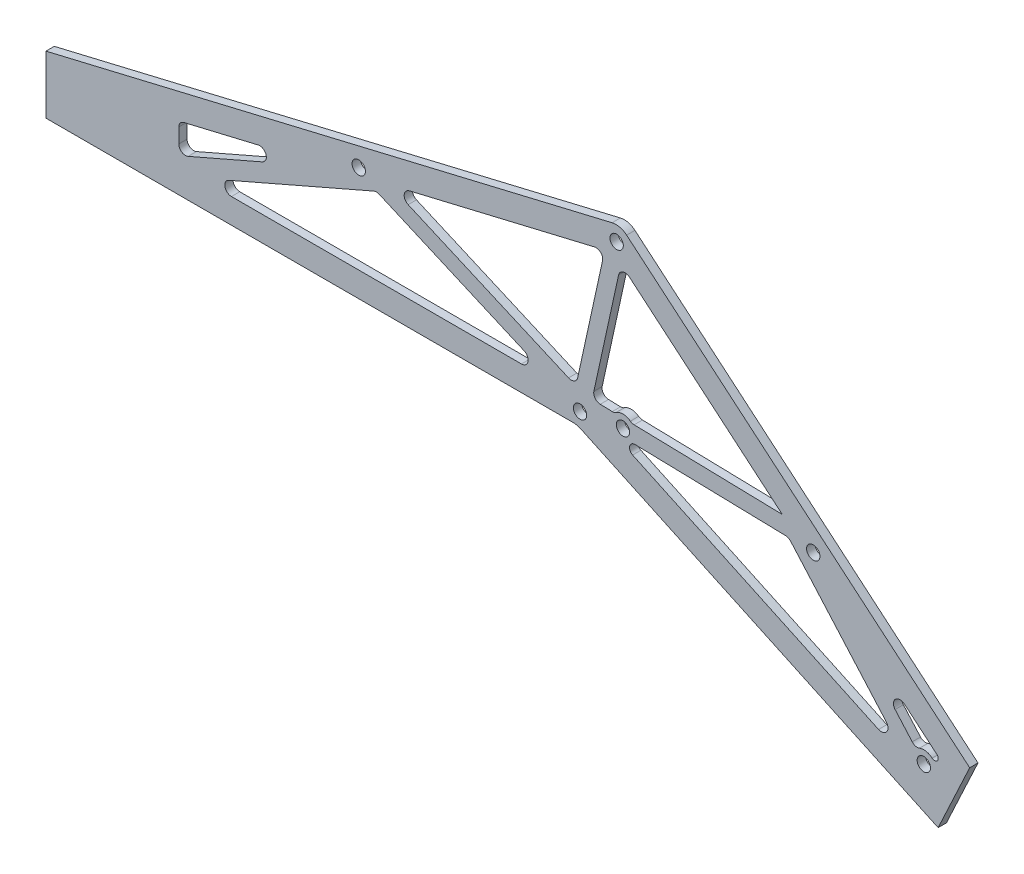
from build123d import *

# Parameters (mm, degrees)
BOSS_EXTRUDE1_DEPTH    = 3.175
CUT_EXTRUDE1_DEPTH     = 3.175
F_10_CLEARANCE_HOLE1_D = 5.1054
FILLET1_R              = 6.35
FILLET2_R              = 2.54
F_10_CLEARANCE_HOLE2_D = 5.1054
FILLET3_DEPTH          = 3.175
FILLET4_DEPTH          = 3.175


with BuildPart() as part:
    # Sketch1 → Boss-Extrude1 (new body)
    with BuildSketch(Plane.XY):
        Polygon((0, 0), (-203.2, 0), (-203.2, 22.225), (16.492698582, 74.393755743), (150.197623574, -38.509278075), (138.121306744, -64.407023089), align=None)
    extrude(amount=BOSS_EXTRUDE1_DEPTH)

    # Sketch2 → Cut-Extrude1 (cut)
    with BuildSketch(Plane.XY.offset(3.175)):
        with BuildLine():
            ThreePointArc((21.24883588, 4.583754924), (18.61914073, 2.941077903), (15.535547838, 3.265329747))
            Line((15.535547838, 3.265329747), (126.332322757, -48.400054896))
            Line((126.332322757, -48.400054896), (80.920020655, 3.146145486))
            Line((80.920020655, 3.146145486), (21.24883588, 4.583754924))
        make_face()
        with BuildLine():
            Line((137.027076007, -44.215538399), (138.486158755, -41.086525347))
            Line((138.486158755, -41.086525347), (98.909290031, -7.667049227))
            Line((98.909290031, -7.667049227), (129.564314023, -42.462686891))
            ThreePointArc((129.564314023, -42.462686891), (133.738335549, -41.454571408), (137.027076007, -44.215538399))
        make_face()
        Polygon((-0.44732738, 12.687080727), (10.590747216, 63.202397136), (-71.622854337, 43.679757896), align=None)
        Polygon((-76.769135969, 38.994763822), (-144.447250959, 9.525), (-9.091020978, 9.525), align=None)
        Polygon((-94.260732486, 38.304112991), (-152.4, 24.498222921), (-152.4, 12.98794568), align=None)
        with BuildLine():
            Line((78.512994475, 9.555978624), (16.762189587, 61.699556828))
            Line((16.762189587, 61.699556828), (5.751368588, 11.308965438))
            Line((5.751368588, 11.308965438), (14.340754941, 11.102028322))
            ThreePointArc((14.340754941, 11.102028322), (17.662973074, 12.342739027), (20.921588597, 10.943481637))
            Line((20.921588597, 10.943481637), (78.512994475, 9.555978624))
        make_face()
    extrude(amount=-CUT_EXTRUDE1_DEPTH, mode=Mode.SUBTRACT)

    # #10 Clearance Hole1 (through all)
    with Locations(Plane.XY.offset(3.175)):
        with Locations((15.118307034, 68.194276097), (1.099513239, 4.959583716), (90.351919236, 2.887547679), (-83.537983118, 43.502605356)):
            Hole(F_10_CLEARANCE_HOLE1_D / 2)

    # Fillet1
    fillet1_edges = [part.edges().sort_by_distance(p)[0] for p in [
        (0, 0, 1.5875),
        (16.492698582, 74.393755743, 1.5875),
    ]]
    fillet(fillet1_edges, radius=FILLET1_R)

    # Fillet2
    fillet2_edges = [part.edges().sort_by_distance(p)[0] for p in [
        (80.920020655, 3.146145486, 1.5875),
        (126.332322757, -48.400054896, 1.5875),
        (20.921588597, 10.943481637, 1.5875),
        (14.340754941, 11.102028322, 1.5875),
        (5.751368588, 11.308965438, 1.5875),
        (16.762189587, 61.699556828, 1.5875),
        (-0.44732738, 12.687080727, 1.5875),
        (-71.622854337, 43.679757896, 1.5875),
        (10.590747216, 63.202397136, 1.5875),
        (-94.260732486, 38.304112991, 1.5875),
        (-152.4, 12.98794568, 1.5875),
        (-152.4, 24.498222921, 1.5875),
        (129.564314023, -42.462686891, 1.5875),
        (98.909290031, -7.667049227, 1.5875),
        (-76.769135969, 38.994763822, 1.5875),
        (-9.091020978, 9.525, 1.5875),
        (-144.447250959, 9.525, 1.5875),
    ]]
    fillet(fillet2_edges, radius=FILLET2_R)

    # #10 Clearance Hole2 (through all)
    with Locations(Plane.XY.offset(3.175)):
        with Locations((17.54826731, 7.581620583), (132.649356264, -46.090898658)):
            Hole(F_10_CLEARANCE_HOLE2_D / 2)

    # Fillet3: read off the stored shape, not the designer's step
    # Fillet3 outline → Fillet3 (add)
    with BuildSketch(Plane.XY):
        with BuildLine():
            Line((15.535547838, 3.265329747), (21.232159568, 0.608956072))
            add(Edge.make_bspline(
                [(21.232159568, 0.608956072), (19.885857145, 1.236747202), (19.378566273, 2.827814172), (20.725192465, 4.03358552)],
                knots=[0, 0, 0, 0, 0.69383671, 0.69383671, 0.69383671, 0.69383671], degree=3, weights=[1, 0.632112013, 0.519478217, 0.662098611]))
            ThreePointArc((20.725192465, 4.03358552), (18.245689672, 2.870462732), (15.535547838, 3.265329747))
        make_face()
        with BuildLine():
            ThreePointArc((21.24883588, 4.583754924), (20.997999412, 4.298214627), (20.725192465, 4.03358552))
            add(Edge.make_bspline(
                [(20.725192465, 4.03358552), (21.150941215, 4.414801664), (21.664082636, 4.573750721), (22.158575797, 4.561837299)],
                knots=[0.69383671, 0.69383671, 0.69383671, 0.69383671, 1, 1, 1, 1], degree=3, weights=[0.662098611, 0.725031472, 0.837665268, 1]))
            Line((22.158575797, 4.561837299), (21.24883588, 4.583754924))
        make_face()
    extrude(amount=FILLET3_DEPTH)

    # Fillet4: read off the stored shape, not the designer's step
    # Fillet4 outline → Fillet4 (add)
    with BuildSketch(Plane.XY):
        with BuildLine():
            Line((138.486158755, -41.086525347), (137.659679105, -40.38862989))
            add(Edge.make_bspline(
                [(137.659679105, -40.38862989), (137.885417825, -40.579248046), (138.092627638, -40.854150437), (138.228700196, -41.219427367), (138.224361363, -41.647951666), (138.029002465, -42.066900176)],
                knots=[0, 0, 0, 0, 0, 0, 0.431143376, 0.431143376, 0.431143376, 0.431143376, 0.431143376, 0.431143376], degree=5, weights=[1, 0.825460303, 0.688546423, 0.58925836, 0.527596114, 0.503559686]))
            Line((138.029002465, -42.066900176), (138.486158755, -41.086525347))
        make_face()
        with BuildLine():
            Line((137.027076007, -44.215538399), (138.029002465, -42.066900176))
            add(Edge.make_bspline(
                [(138.029002465, -42.066900176), (137.740787916, -42.684978272), (137.186504044, -43.023143687), (136.590787826, -43.018448848), (136.121756233, -42.804773213), (135.808946692, -42.527417975)],
                knots=[0.431143376, 0.431143376, 0.431143376, 0.431143376, 0.431143376, 0.431143376, 1, 1, 1, 1, 1, 1], degree=5, weights=[0.503559686, 0.471845684, 0.505632715, 0.604920778, 0.769709873, 1]))
            ThreePointArc((135.808946692, -42.527417975), (136.511376305, -43.304107052), (137.027076007, -44.215538399))
        make_face()
    extrude(amount=FILLET4_DEPTH)


solid = part.part
